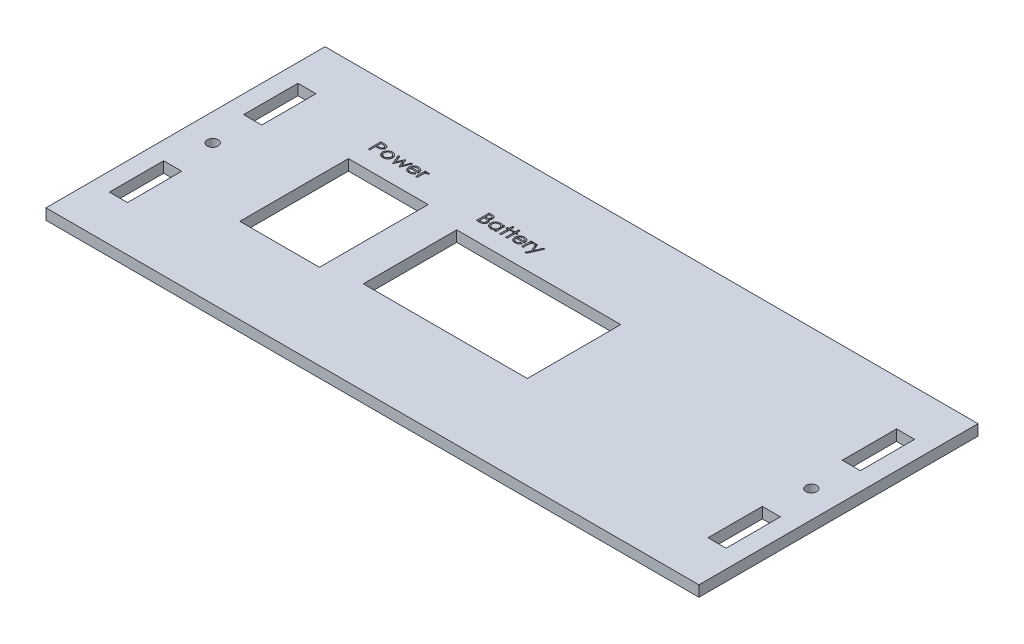
from build123d import *

# Parameters (mm, degrees)
SCHIZZO1_W                   = 180.34
SCHIZZO1_H                   = 77.07
ESTRUSIONE_ESTRUSIONE1_DEPTH = 3
SCHIZZO2_R                   = 1.5
SCHIZZO2_W                   = 5
SCHIZZO2_H                   = 15
TAGLIO_ESTRUSIONE1_DEPTH     = 99.104918964
SCHIZZO3_W                   = 45.3
SCHIZZO3_H                   = 25.8
SCHIZZO3_W_2                 = 22
SCHIZZO3_H_2                 = 30
TAGLIO_ESTRUSIONE2_DEPTH     = 99.104918964
TAGLIO_ESTRUSIONE3_DEPTH     = 1
TAGLIO_ESTRUSIONE4_DEPTH     = 1


with BuildPart() as part:
    # Schizzo1 → Estrusione-Estrusione1 (new body)
    with BuildSketch(Plane(origin=(0, 0, 0), x_dir=(1, 0, 0), z_dir=(0, 1, 0))):
        Rectangle(SCHIZZO1_W, SCHIZZO1_H)
    extrude(amount=ESTRUSIONE_ESTRUSIONE1_DEPTH)

    # Schizzo2 → Taglio-Estrusione1 (cut, through all)
    with BuildSketch(Plane(origin=(0, 0, 0), x_dir=(1, 0, 0), z_dir=(0, 1, 0))):
        with Locations((-82.67, 0)):
            Circle(SCHIZZO2_R)
        with Locations((82.67, 0)):
            Circle(SCHIZZO2_R)
        with Locations((-82.67, 18.535)):
            Rectangle(SCHIZZO2_W, SCHIZZO2_H)
        with Locations((-82.67, -18.535)):
            Rectangle(SCHIZZO2_W, SCHIZZO2_H)
        with Locations((82.67, -18.535)):
            Rectangle(SCHIZZO2_W, SCHIZZO2_H)
        with Locations((82.67, 18.535)):
            Rectangle(SCHIZZO2_W, SCHIZZO2_H)
    extrude(amount=TAGLIO_ESTRUSIONE1_DEPTH, mode=Mode.SUBTRACT)

    # Schizzo3 → Taglio-Estrusione2 (cut, through all)
    with BuildSketch(Plane(origin=(0, 0, 0), x_dir=(1, 0, 0), z_dir=(0, 1, 0))):
        with Locations((-5.52, 0)):
            Rectangle(SCHIZZO3_W, SCHIZZO3_H)
        with Locations((-49.17, 0)):
            Rectangle(SCHIZZO3_W_2, SCHIZZO3_H_2)
    extrude(amount=TAGLIO_ESTRUSIONE2_DEPTH, mode=Mode.SUBTRACT)

    # Schizzo4 → Taglio-Estrusione3 (cut)
    # profile 1 of 7: a face of its own
    with BuildSketch(Plane(origin=(0, 3, 0), x_dir=(1, 0, 0), z_dir=(0, 1, 0))):
        with BuildLine():
            Line((-27.721282051, 21.4), (-27.010344551, 21.4))
            add(Edge.make_bspline(
                [(-27.010344551, 21.4), (-26.975512489, 21.399880445), (-26.907901877, 21.399648383), (-26.809468419, 21.393576376), (-26.716881837, 21.385217637), (-26.629900509, 21.374684472), (-26.549090313, 21.358760238), (-26.474003053, 21.341039616), (-26.404852856, 21.319273206), (-26.32181816, 21.285928555), (-26.22684833, 21.236763452), (-26.12618551, 21.162915024), (-26.038636629, 21.07645617), (-25.966219425, 20.977667295), (-25.908930469, 20.870498168), (-25.866837195, 20.757921064), (-25.841651906, 20.640627626), (-25.838334155, 20.560876083), (-25.836666667, 20.520793269)],
                knots=[0, 0, 0, 0, 1.007958579, 1.956493294, 2.853051435, 3.69876748, 4.490758369, 5.235590101, 5.930857791, 6.586533057, 7.824014415, 9.014592828, 10.186442765, 11.371570779, 12.545761065, 13.692928573, 14.840474926, 16, 16, 16, 16], degree=3))
            add(Edge.make_bspline(
                [(-25.836666667, 20.520793269), (-25.838097439, 20.483316811), (-25.840925182, 20.409249289), (-25.861017361, 20.300045305), (-25.894740632, 20.195158689), (-25.941805515, 20.096228704), (-25.998673946, 20.004881066), (-26.068761704, 19.927059819), (-26.147555195, 19.860768065), (-26.207610576, 19.828721119), (-26.237708333, 19.812660256)],
                knots=[0, 0, 0, 0, 1.049068526, 2.073352407, 3.097740801, 4.125217979, 5.134529868, 6.0985968, 7.047080017, 8, 8, 8, 8], degree=3))
            add(Edge.make_bspline(
                [(-26.237708333, 19.812660256), (-26.201903156, 19.800772337), (-26.132238439, 19.777642484), (-26.034681131, 19.731486439), (-25.946353959, 19.677660249), (-25.868124222, 19.614722255), (-25.799552695, 19.544896005), (-25.738426844, 19.47013794), (-25.686314196, 19.389282289), (-25.643948432, 19.302651098), (-25.60900148, 19.212570596), (-25.585697898, 19.11852298), (-25.570121078, 19.022079984), (-25.56833643, 18.956652487), (-25.567435897, 18.923637821)],
                knots=[0, 0, 0, 0, 1.133419977, 2.205250392, 3.236826218, 4.236512947, 5.215313127, 6.174419893, 7.135300951, 8.100002318, 9.069604306, 10.034177721, 11.008047523, 12, 12, 12, 12], degree=3))
            add(Edge.make_bspline(
                [(-25.567435897, 18.923637821), (-25.568373631, 18.88946805), (-25.570225923, 18.821972997), (-25.585135888, 18.722434596), (-25.610833484, 18.626804781), (-25.644974124, 18.534107631), (-25.690420006, 18.445507835), (-25.745386093, 18.360259095), (-25.810399726, 18.278738965), (-25.884095559, 18.201278669), (-25.966688213, 18.130332131), (-26.057305054, 18.068652309), (-26.155095664, 18.016330709), (-26.260040649, 17.973323162), (-26.372738829, 17.940781259), (-26.492313636, 17.916867379), (-26.619018961, 17.902850181), (-26.705789048, 17.900965328), (-26.750228365, 17.9)],
                knots=[0, 0, 0, 0, 0.936774787, 1.85039767, 2.752028152, 3.648404466, 4.554125646, 5.47676296, 6.425627069, 7.40928418, 8.404729492, 9.405524488, 10.409085955, 11.440939351, 12.509690097, 13.620780345, 14.781482169, 16, 16, 16, 16], degree=3))
            Line((-26.750228365, 17.9), (-27.721282051, 17.9))
            Line((-27.721282051, 17.9), (-27.721282051, 21.4))
        make_face()
        with BuildLine():
            Line((-27.272564103, 20.996153846), (-27.272564103, 19.964102564))
            Line((-27.272564103, 19.964102564), (-27.159683494, 19.964102564))
            add(Edge.make_bspline(
                [(-27.159683494, 19.964102564), (-27.130464212, 19.96408051), (-27.074338657, 19.964038149), (-26.993242775, 19.968072108), (-26.918393486, 19.972582628), (-26.84959971, 19.979447893), (-26.78722123, 19.988761286), (-26.730607698, 19.998736631), (-26.680586197, 20.012102039), (-26.622537206, 20.031433106), (-26.558319564, 20.062133955), (-26.489104124, 20.107314707), (-26.428771312, 20.161983159), (-26.377929364, 20.225144014), (-26.336204248, 20.294303656), (-26.306819661, 20.368471797), (-26.288265652, 20.446265232), (-26.286354631, 20.499420924), (-26.285384615, 20.526402244)],
                knots=[0, 0, 0, 0, 1.189795604, 2.285406617, 3.306016107, 4.243629591, 5.09972607, 5.874440047, 6.583200089, 7.20625147, 8.364329942, 9.470433385, 10.562068177, 11.665054906, 12.761988123, 13.838370909, 14.902777763, 16, 16, 16, 16], degree=3))
            add(Edge.make_bspline(
                [(-26.285384615, 20.526402244), (-26.285634902, 20.544200578), (-26.286124866, 20.579042867), (-26.294431679, 20.62944457), (-26.305994173, 20.677388781), (-26.323720561, 20.721922497), (-26.345587657, 20.763896296), (-26.372412414, 20.802990571), (-26.40502718, 20.838425413), (-26.441607342, 20.871956681), (-26.484090624, 20.901734181), (-26.532961437, 20.926550351), (-26.587438684, 20.948789004), (-26.6485148, 20.96558324), (-26.715635846, 20.979951636), (-26.78903247, 20.989351791), (-26.868631587, 20.994882044), (-26.923629504, 20.995719527), (-26.952151442, 20.996153846)],
                knots=[0, 0, 0, 0, 0.920588044, 1.802157111, 2.638793445, 3.470424406, 4.277107445, 5.086238418, 5.917516993, 6.765890369, 7.652348103, 8.594329737, 9.598999334, 10.694623565, 11.869668103, 13.151790333, 14.522917531, 16, 16, 16, 16], degree=3))
            Line((-26.952151442, 20.996153846), (-27.272564103, 20.996153846))
        make_face(mode=Mode.SUBTRACT)
        with BuildLine():
            Line((-27.272564103, 19.56025641), (-27.272564103, 18.303846154))
            Line((-27.272564103, 18.303846154), (-26.929014423, 18.303846154))
            add(Edge.make_bspline(
                [(-26.929014423, 18.303846154), (-26.898865922, 18.304238817), (-26.8406601, 18.304996906), (-26.756685706, 18.307296665), (-26.67906548, 18.313117782), (-26.607961618, 18.320659123), (-26.543018276, 18.330079436), (-26.485122777, 18.342963233), (-26.433096486, 18.356573094), (-26.373216733, 18.378807692), (-26.306200799, 18.413291383), (-26.233333251, 18.463240598), (-26.170069139, 18.524355432), (-26.115612678, 18.593476378), (-26.07127903, 18.668850002), (-26.039718232, 18.748563163), (-26.019692229, 18.831043445), (-26.01733736, 18.887067636), (-26.016153846, 18.915224359)],
                knots=[0, 0, 0, 0, 1.163785926, 2.246848597, 3.241725633, 4.167152819, 5.00659376, 5.772700295, 6.455464292, 7.08048881, 8.234268396, 9.355318846, 10.478218647, 11.615125307, 12.742977958, 13.840148171, 14.914498376, 16, 16, 16, 16], degree=3))
            add(Edge.make_bspline(
                [(-26.016153846, 18.915224359), (-26.017560683, 18.950470246), (-26.020323742, 19.019693993), (-26.048489164, 19.119385816), (-26.092537184, 19.212300006), (-26.154016566, 19.297120456), (-26.230779686, 19.372625552), (-26.322468733, 19.435368625), (-26.427765032, 19.484990943), (-26.503991972, 19.506875761), (-26.543397436, 19.518189103)],
                knots=[0, 0, 0, 0, 0.973192407, 1.911372656, 2.842841623, 3.806662698, 4.794486549, 5.808057144, 6.866876674, 8, 8, 8, 8], degree=3))
            add(Edge.make_bspline(
                [(-26.543397436, 19.518189103), (-26.559724083, 19.521647207), (-26.594778311, 19.529071951), (-26.651982829, 19.536884735), (-26.716883534, 19.545048825), (-26.790168434, 19.549908165), (-26.871453874, 19.555409586), (-26.961029012, 19.557471783), (-27.058708175, 19.559987803), (-27.12649469, 19.560164444), (-27.161786859, 19.56025641)],
                knots=[0, 0, 0, 0, 0.644909758, 1.384657469, 2.230684102, 3.173004705, 4.222865052, 5.379792601, 6.635823043, 8, 8, 8, 8], degree=3))
            Line((-27.161786859, 19.56025641), (-27.272564103, 19.56025641))
        make_face(mode=Mode.SUBTRACT)
    # profile 2 of 7: a face of its own
    with BuildSketch(Plane(origin=(0, 3, 0), x_dir=(1, 0, 0), z_dir=(0, 1, 0))):
        with BuildLine():
            Line((-22.336666667, 20.502564103), (-22.336666667, 17.9))
            Line((-22.336666667, 17.9), (-22.785384615, 17.9))
            Line((-22.785384615, 17.9), (-22.785384615, 18.333994391))
            add(Edge.make_bspline(
                [(-22.785384615, 18.333994391), (-22.793361161, 18.315314052), (-22.809373824, 18.277813859), (-22.8413969, 18.225375017), (-22.878868795, 18.175715991), (-22.922459636, 18.129523627), (-22.971832724, 18.086646396), (-23.026900537, 18.047061761), (-23.088263386, 18.011609802), (-23.177227671, 17.967711362), (-23.296191519, 17.922173841), (-23.44661922, 17.884129375), (-23.603695085, 17.859106968), (-23.711001395, 17.856469181), (-23.765552885, 17.855128205)],
                knots=[0, 0, 0, 0, 0.633448184, 1.271627253, 1.912262546, 2.572984541, 3.250455464, 3.951067024, 4.686888255, 5.460243522, 7.046999963, 8.652120303, 10.298032742, 12, 12, 12, 12], degree=3))
            add(Edge.make_bspline(
                [(-23.765552885, 17.855128205), (-23.811418195, 17.856369648), (-23.901880305, 17.8588182), (-24.035096162, 17.877377496), (-24.163046225, 17.908263129), (-24.286037047, 17.951181697), (-24.403723815, 18.006961755), (-24.516158118, 18.075236832), (-24.62315312, 18.155893156), (-24.724122506, 18.246886124), (-24.815975801, 18.347259759), (-24.897283196, 18.453967095), (-24.965338438, 18.566807845), (-25.022103275, 18.684433455), (-25.065715225, 18.807887039), (-25.096427409, 18.936665013), (-25.115071566, 19.070795247), (-25.117489193, 19.161959259), (-25.118717949, 19.208293269)],
                knots=[0, 0, 0, 0, 1.033362466, 2.038144899, 3.024299931, 3.995390054, 4.968377829, 5.953815345, 6.954489863, 7.983669828, 9.012499361, 10.016342745, 11.001780262, 11.977031811, 12.954839801, 13.946114836, 14.956115094, 16, 16, 16, 16], degree=3))
            add(Edge.make_bspline(
                [(-25.118717949, 19.208293269), (-25.117551711, 19.253470911), (-25.115245014, 19.342827615), (-25.095522322, 19.474030275), (-25.065185966, 19.600705918), (-25.020287812, 19.721655844), (-24.96411646, 19.83813144), (-24.894863907, 19.949403726), (-24.812973435, 20.05561637), (-24.71988298, 20.155723156), (-24.617592203, 20.24648783), (-24.509854222, 20.327365345), (-24.396693123, 20.395606271), (-24.278312973, 20.451387748), (-24.154623307, 20.494308255), (-24.026197134, 20.52510673), (-23.8925365, 20.543792215), (-23.801837647, 20.546208001), (-23.755737179, 20.547435897)],
                knots=[0, 0, 0, 0, 1.020618803, 2.018678488, 2.992382782, 3.959992561, 4.92863996, 5.910776111, 6.916619819, 7.955690666, 8.995808327, 10.003702857, 10.996604865, 11.977276721, 12.956254092, 13.950490127, 14.958273908, 16, 16, 16, 16], degree=3))
            add(Edge.make_bspline(
                [(-23.755737179, 20.547435897), (-23.700008917, 20.545917648), (-23.590763033, 20.542941376), (-23.431183615, 20.516639038), (-23.279160064, 20.475742758), (-23.159921353, 20.426655708), (-23.071124943, 20.37985478), (-23.011005995, 20.341513262), (-22.956786609, 20.29998921), (-22.909973497, 20.25418783), (-22.86869729, 20.205610121), (-22.834226289, 20.153322912), (-22.805623648, 20.097676276), (-22.792155872, 20.058246013), (-22.785384615, 20.038421474)],
                knots=[0, 0, 0, 0, 1.716657277, 3.365217784, 4.971270217, 6.560530054, 7.327512158, 8.062889103, 8.755980397, 9.428436733, 10.077769018, 10.717114698, 11.354997714, 12, 12, 12, 12], degree=3))
            Line((-22.785384615, 20.038421474), (-22.785384615, 20.502564103))
            Line((-22.785384615, 20.502564103), (-22.336666667, 20.502564103))
        make_face()
        with BuildLine():
            add(Edge.make_bspline(
                [(-23.748725962, 20.143589744), (-23.788324706, 20.14232667), (-23.866733023, 20.139825695), (-23.982030498, 20.117225876), (-24.093230959, 20.080469814), (-24.199401325, 20.029204152), (-24.299716105, 19.965032549), (-24.389973385, 19.885265574), (-24.471135712, 19.792758526), (-24.541320308, 19.688149896), (-24.598622903, 19.57501791), (-24.639769592, 19.45545334), (-24.665053417, 19.331585329), (-24.668345206, 19.247205622), (-24.67, 19.20478766)],
                knots=[0, 0, 0, 0, 0.974506396, 1.929591628, 2.881601621, 3.852224148, 4.826169364, 5.805204388, 6.808608303, 7.849533547, 8.899838684, 9.922896291, 10.95583298, 12, 12, 12, 12], degree=3))
            add(Edge.make_bspline(
                [(-24.67, 19.20478766), (-24.668362239, 19.162366559), (-24.665113185, 19.078209948), (-24.639575836, 18.95409819), (-24.598068364, 18.834005517), (-24.539730846, 18.719882471), (-24.469189516, 18.614361337), (-24.387929728, 18.520499478), (-24.29672466, 18.440757759), (-24.1970887, 18.374441159), (-24.090399899, 18.323945187), (-23.980538566, 18.285956777), (-23.866937764, 18.26370269), (-23.790185842, 18.260558102), (-23.751530449, 18.258974359)],
                knots=[0, 0, 0, 0, 1.043890897, 2.07091085, 3.106456601, 4.164214128, 5.217626504, 6.225096955, 7.211993606, 8.19198703, 9.162352883, 10.110485497, 11.048363551, 12, 12, 12, 12], degree=3))
            add(Edge.make_bspline(
                [(-23.751530449, 18.258974359), (-23.708891792, 18.260431131), (-23.624378026, 18.263318589), (-23.499401711, 18.287352734), (-23.3785878, 18.326968045), (-23.262284392, 18.380672624), (-23.154650277, 18.448048041), (-23.057900062, 18.52674041), (-22.97608005, 18.617872304), (-22.906771277, 18.718185074), (-22.853118995, 18.828094688), (-22.813281577, 18.944533683), (-22.789616958, 19.068049653), (-22.786814078, 19.152568613), (-22.785384615, 19.195673077)],
                knots=[0, 0, 0, 0, 1.022399401, 2.026490321, 3.040784809, 4.066867991, 5.092169477, 6.080081507, 7.048709079, 8.02078757, 8.996288655, 9.973335651, 10.966406111, 12, 12, 12, 12], degree=3))
            add(Edge.make_bspline(
                [(-22.785384615, 19.195673077), (-22.786114094, 19.228671903), (-22.787553375, 19.293779438), (-22.801278882, 19.389113876), (-22.823168779, 19.480387326), (-22.852910436, 19.567664895), (-22.893035345, 19.650200105), (-22.940358037, 19.729218188), (-22.998138049, 19.803004777), (-23.062685987, 19.872652893), (-23.133776148, 19.936089876), (-23.209476286, 19.991766751), (-23.2897653, 20.03840592), (-23.373648125, 20.077227675), (-23.462033882, 20.106329427), (-23.553817335, 20.128663706), (-23.649987927, 20.141170097), (-23.715505585, 20.142775654), (-23.748725962, 20.143589744)],
                knots=[0, 0, 0, 0, 1.049538253, 2.070766012, 3.057425551, 4.033461752, 4.998098599, 5.972518539, 6.958729546, 7.974309418, 8.990869055, 9.985984514, 10.959183395, 11.940869635, 12.921541271, 13.915433273, 14.94303162, 16, 16, 16, 16], degree=3))
        make_face(mode=Mode.SUBTRACT)
    # profile 3 of 7: a face of its own
    with BuildSketch(Plane(origin=(0, 3, 0), x_dir=(1, 0, 0), z_dir=(0, 1, 0))):
        Polygon((-21.304615385, 21.48974359), (-20.855897436, 21.48974359), (-20.855897436, 20.502564103), (-20.407179487, 20.502564103), (-20.407179487, 20.098717949), (-20.855897436, 20.098717949), (-20.855897436, 17.9), (-21.304615385, 17.9), (-21.304615385, 20.098717949), (-21.753333333, 20.098717949), (-21.753333333, 20.502564103), (-21.304615385, 20.502564103), align=None)
    # profile 4 of 7: a face of its own
    with BuildSketch(Plane(origin=(0, 3, 0), x_dir=(1, 0, 0), z_dir=(0, 1, 0))):
        Polygon((-19.644358974, 21.48974359), (-19.195641026, 21.48974359), (-19.195641026, 20.502564103), (-18.746923077, 20.502564103), (-18.746923077, 20.098717949), (-19.195641026, 20.098717949), (-19.195641026, 17.9), (-19.644358974, 17.9), (-19.644358974, 20.098717949), (-20.093076923, 20.098717949), (-20.093076923, 20.502564103), (-19.644358974, 20.502564103), align=None)
    # profile 5 of 7: a face of its own
    with BuildSketch(Plane(origin=(0, 3, 0), x_dir=(1, 0, 0), z_dir=(0, 1, 0))):
        with BuildLine():
            Line((-16.159082532, 18.797435897), (-15.785384615, 18.61864984))
            add(Edge.make_bspline(
                [(-15.785384615, 18.61864984), (-15.809010227, 18.575713264), (-15.855019004, 18.492098104), (-15.93352693, 18.376635147), (-16.018727888, 18.275091936), (-16.109793751, 18.186344646), (-16.207860642, 18.110414222), (-16.311163494, 18.04305139), (-16.421893351, 17.986568005), (-16.538629041, 17.938287878), (-16.662902934, 17.901134528), (-16.794562028, 17.874740251), (-16.933875366, 17.858298432), (-17.02936196, 17.856201752), (-17.078253205, 17.855128205)],
                knots=[0, 0, 0, 0, 1.110387997, 2.162381809, 3.158716456, 4.110235088, 5.03849693, 5.965639636, 6.901458115, 7.851707839, 8.825366416, 9.836184406, 10.892078622, 12, 12, 12, 12], degree=3))
            add(Edge.make_bspline(
                [(-17.078253205, 17.855128205), (-17.12997422, 17.85619375), (-17.231003995, 17.858275142), (-17.377855545, 17.878734593), (-17.516423654, 17.90969504), (-17.646206357, 17.954535505), (-17.766702715, 18.013428941), (-17.879350535, 18.083749316), (-17.982825903, 18.167682165), (-18.076140685, 18.263814107), (-18.159032361, 18.367637776), (-18.233115694, 18.475062862), (-18.293710458, 18.587167164), (-18.344888855, 18.701786948), (-18.384284334, 18.820158423), (-18.412196367, 18.941762673), (-18.429724411, 19.066857371), (-18.431779853, 19.151444688), (-18.432820513, 19.194270833)],
                knots=[0, 0, 0, 0, 1.164566152, 2.274817246, 3.333639364, 4.359360714, 5.360157823, 6.349126428, 7.344925074, 8.35392925, 9.361228562, 10.335284257, 11.289572886, 12.22779236, 13.160187688, 14.095091993, 15.035554391, 16, 16, 16, 16], degree=3))
            add(Edge.make_bspline(
                [(-18.432820513, 19.194270833), (-18.431909352, 19.234283481), (-18.430102088, 19.313647593), (-18.414687847, 19.430856717), (-18.391189664, 19.544961696), (-18.357341052, 19.655496005), (-18.313534007, 19.76265419), (-18.26009722, 19.866585297), (-18.196994223, 19.967260265), (-18.1482361, 20.030393557), (-18.123625801, 20.062259615)],
                knots=[0, 0, 0, 0, 1.021096707, 2.025320431, 3.012923591, 3.992437812, 4.971861174, 5.964497656, 6.972595394, 8, 8, 8, 8], degree=3))
            add(Edge.make_bspline(
                [(-18.123625801, 20.062259615), (-18.090345096, 20.100923157), (-18.024747571, 20.177130456), (-17.912956534, 20.276250754), (-17.79315261, 20.360586772), (-17.664546438, 20.428665336), (-17.528091536, 20.482756513), (-17.383008687, 20.520155189), (-17.229726533, 20.543101737), (-17.124843043, 20.545970041), (-17.071241987, 20.547435897)],
                knots=[0, 0, 0, 0, 1.018725525, 2.007946416, 2.977291296, 3.940674949, 4.909614547, 5.904411593, 6.929042575, 8, 8, 8, 8], degree=3))
            add(Edge.make_bspline(
                [(-17.071241987, 20.547435897), (-17.01342573, 20.546103701), (-16.900547222, 20.543502765), (-16.736330081, 20.518887887), (-16.581438499, 20.480007065), (-16.436261379, 20.424339559), (-16.300505214, 20.352955146), (-16.174206222, 20.266145294), (-16.05712325, 20.163400461), (-15.989397274, 20.08372807), (-15.95505609, 20.043329327)],
                knots=[0, 0, 0, 0, 1.092510559, 2.132980742, 3.131821249, 4.106721871, 5.065344059, 6.025034973, 6.998572742, 8, 8, 8, 8], degree=3))
            add(Edge.make_bspline(
                [(-15.95505609, 20.043329327), (-15.931011616, 20.012009867), (-15.883076729, 19.949571624), (-15.823024007, 19.847261463), (-15.770794402, 19.739811955), (-15.727768032, 19.625824043), (-15.695414156, 19.505433817), (-15.670388549, 19.379502668), (-15.655957998, 19.247411787), (-15.652984335, 19.157377603), (-15.651470353, 19.111538462)],
                knots=[0, 0, 0, 0, 0.947891001, 1.889708495, 2.844047414, 3.816063809, 4.811874475, 5.836031954, 6.898258033, 8, 8, 8, 8], degree=3))
            Line((-15.651470353, 19.111538462), (-17.984803686, 19.111538462))
            add(Edge.make_bspline(
                [(-17.984803686, 19.111538462), (-17.983599962, 19.081792695), (-17.981236122, 19.023378765), (-17.966340556, 18.938068688), (-17.945671914, 18.85623335), (-17.916708107, 18.777999741), (-17.880041567, 18.703318464), (-17.835817394, 18.63223848), (-17.783366647, 18.565299832), (-17.724166181, 18.502690254), (-17.659573111, 18.445725464), (-17.591327677, 18.395676129), (-17.519943767, 18.35290522), (-17.4449754, 18.318961195), (-17.36714357, 18.291721885), (-17.286208287, 18.273329362), (-17.202293053, 18.260490191), (-17.145143729, 18.259484975), (-17.116113782, 18.258974359)],
                knots=[0, 0, 0, 0, 1.056285998, 2.074305788, 3.068874036, 4.051103373, 5.031155672, 6.019259974, 7.018838325, 8.046424154, 9.075617995, 10.073437039, 11.048590896, 12.025474346, 12.991505956, 13.972050267, 14.969869311, 16, 16, 16, 16], degree=3))
            add(Edge.make_bspline(
                [(-17.116113782, 18.258974359), (-17.084990536, 18.259559574), (-17.023006061, 18.260725077), (-16.931237302, 18.272820221), (-16.8407812, 18.289773019), (-16.75316227, 18.315463309), (-16.669043758, 18.345534318), (-16.591052888, 18.381427433), (-16.519873946, 18.421345631), (-16.4527792, 18.467525058), (-16.385935999, 18.52542373), (-16.315515173, 18.599876046), (-16.238673043, 18.692149402), (-16.186822779, 18.760739646), (-16.159082532, 18.797435897)],
                knots=[0, 0, 0, 0, 0.974501181, 1.940798391, 2.895710587, 3.855187413, 4.797895034, 5.692306932, 6.541458453, 7.351844759, 8.239729442, 9.306468335, 10.558942083, 12, 12, 12, 12], degree=3))
        make_face()
        with BuildLine():
            add(Edge.make_bspline(
                [(-16.099487179, 19.515384615), (-16.110857659, 19.544371821), (-16.133535271, 19.602184742), (-16.177195739, 19.684256266), (-16.228891864, 19.760902105), (-16.287177592, 19.833290991), (-16.355026278, 19.899892501), (-16.433533164, 19.959331493), (-16.521832697, 20.013226529), (-16.619950203, 20.058419665), (-16.724009331, 20.096124264), (-16.831945226, 20.123756061), (-16.942660966, 20.140233197), (-17.017434532, 20.142465027), (-17.055116186, 20.143589744)],
                knots=[0, 0, 0, 0, 0.917468198, 1.829825112, 2.733739057, 3.639830069, 4.565591991, 5.528900948, 6.536885056, 7.609579627, 8.708054817, 9.795976896, 10.889296829, 12, 12, 12, 12], degree=3))
            add(Edge.make_bspline(
                [(-17.055116186, 20.143589744), (-17.083887984, 20.142863894), (-17.140896895, 20.141425683), (-17.225140467, 20.131542886), (-17.306810171, 20.114756514), (-17.385867978, 20.090725758), (-17.462254694, 20.05977809), (-17.536404036, 20.022353989), (-17.608038309, 19.978344962), (-17.65297882, 19.944158151), (-17.675608974, 19.926943109)],
                knots=[0, 0, 0, 0, 1.030056501, 2.040970785, 3.032161429, 4.011555994, 4.995123754, 5.979296403, 6.982458509, 8, 8, 8, 8], degree=3))
            add(Edge.make_bspline(
                [(-17.675608974, 19.926943109), (-17.70434393, 19.901647995), (-17.763151914, 19.849879875), (-17.836155638, 19.75270686), (-17.901830088, 19.641298487), (-17.934740175, 19.558456343), (-17.951850962, 19.515384615)],
                knots=[0, 0, 0, 0, 0.913853049, 1.870260628, 2.892694598, 4, 4, 4, 4], degree=3))
            Line((-17.951850962, 19.515384615), (-16.099487179, 19.515384615))
        make_face(mode=Mode.SUBTRACT)
    # profile 6 of 7: a face of its own
    with BuildSketch(Plane(origin=(0, 3, 0), x_dir=(1, 0, 0), z_dir=(0, 1, 0))):
        with BuildLine():
            Line((-15.246923077, 20.502564103), (-14.798205128, 20.502564103))
            Line((-14.798205128, 20.502564103), (-14.798205128, 20.133072917))
            add(Edge.make_bspline(
                [(-14.798205128, 20.133072917), (-14.79549756, 20.149966016), (-14.79021277, 20.182938951), (-14.776882172, 20.230322614), (-14.758444238, 20.274314631), (-14.735268936, 20.314965055), (-14.707784562, 20.352428287), (-14.675712197, 20.386470293), (-14.639201034, 20.417567897), (-14.583962753, 20.453112014), (-14.511438504, 20.490706482), (-14.420440016, 20.523332794), (-14.327281736, 20.544001661), (-14.264055421, 20.546290128), (-14.23239984, 20.547435897)],
                knots=[0, 0, 0, 0, 0.801625561, 1.56465941, 2.301277113, 3.032414989, 3.753384473, 4.4742707, 5.220602463, 5.995500889, 7.548895402, 9.039144265, 10.517585467, 12, 12, 12, 12], degree=3))
            add(Edge.make_bspline(
                [(-14.23239984, 20.547435897), (-14.203768846, 20.545735685), (-14.143618661, 20.54216375), (-14.051225226, 20.518348411), (-13.953935443, 20.479042544), (-13.889673957, 20.443907866), (-13.855897436, 20.425440705)],
                knots=[0, 0, 0, 0, 0.858860638, 1.804360244, 2.845948385, 4, 4, 4, 4], degree=3))
            Line((-13.855897436, 20.425440705), (-14.06833734, 20.099419071))
            add(Edge.make_bspline(
                [(-14.06833734, 20.099419071), (-14.092569686, 20.106273931), (-14.136837664, 20.118796482), (-14.197856951, 20.131553766), (-14.246135533, 20.141222376), (-14.274439008, 20.142887061), (-14.286386218, 20.143589744)],
                knots=[0, 0, 0, 0, 1.354987806, 2.475310119, 3.356411532, 4, 4, 4, 4], degree=3))
            add(Edge.make_bspline(
                [(-14.286386218, 20.143589744), (-14.305962625, 20.142154169), (-14.347166215, 20.139132632), (-14.408630402, 20.115384327), (-14.471737208, 20.078744425), (-14.523729061, 20.037718289), (-14.565439111, 19.997617549), (-14.595280444, 19.960833648), (-14.62424264, 19.919203509), (-14.651431571, 19.87230556), (-14.676523382, 19.820100375), (-14.700253352, 19.763190078), (-14.723048048, 19.701359658), (-14.73561601, 19.657801852), (-14.742115385, 19.635276442)],
                knots=[0, 0, 0, 0, 0.965356871, 2.031842204, 3.216327082, 4.56533618, 5.292082419, 6.07124699, 6.900886396, 7.796081313, 8.746333432, 9.760722644, 10.841983902, 12, 12, 12, 12], degree=3))
            add(Edge.make_bspline(
                [(-14.742115385, 19.635276442), (-14.746861071, 19.61664213), (-14.75750873, 19.574833261), (-14.76753307, 19.503858549), (-14.777625898, 19.419049217), (-14.784725676, 19.320066033), (-14.791269285, 19.207191629), (-14.794991349, 19.080005947), (-14.798077852, 18.938610388), (-14.798161392, 18.839505448), (-14.798205128, 18.787620192)],
                knots=[0, 0, 0, 0, 0.541796663, 1.215601946, 2.018210726, 2.950106988, 4.012619945, 5.205915212, 6.537188929, 8, 8, 8, 8], degree=3))
            Line((-14.798205128, 18.787620192), (-14.798205128, 17.9))
            Line((-14.798205128, 17.9), (-15.246923077, 17.9))
            Line((-15.246923077, 17.9), (-15.246923077, 20.502564103))
        make_face()
    # profile 7 of 7: a face of its own
    with BuildSketch(Plane(origin=(0, 3, 0), x_dir=(1, 0, 0), z_dir=(0, 1, 0))):
        Polygon((-13.900769231, 20.502564103), (-13.447143429, 20.502564103), (-12.626830929, 18.580088141), (-11.802311699, 20.502564103), (-11.343076923, 20.502564103), (-12.933922276, 16.957692308), (-13.388249199, 16.957692308), (-12.862407853, 18.158713942), align=None)
    extrude(amount=-TAGLIO_ESTRUSIONE3_DEPTH, mode=Mode.SUBTRACT)

    # Schizzo5 → Taglio-Estrusione4 (cut)
    # profile 1 of 5: a face of its own
    with BuildSketch(Plane(origin=(0, 3, 0), x_dir=(1, 0, 0), z_dir=(0, 1, 0))):
        with BuildLine():
            Line((-59.721282051, 23.5), (-59.004034455, 23.5))
            add(Edge.make_bspline(
                [(-59.004034455, 23.5), (-58.956589121, 23.499974153), (-58.865662184, 23.499924617), (-58.735263232, 23.496567938), (-58.616962019, 23.493670846), (-58.510583749, 23.488102386), (-58.416370619, 23.480474665), (-58.334288809, 23.471505378), (-58.264250186, 23.461417408), (-58.222011407, 23.452297078), (-58.202652244, 23.448116987)],
                knots=[0, 0, 0, 0, 1.415450773, 2.712650385, 3.891531898, 4.945867971, 5.890285756, 6.71109784, 7.409261617, 8, 8, 8, 8], degree=3))
            add(Edge.make_bspline(
                [(-58.202652244, 23.448116987), (-58.175399632, 23.441108824), (-58.121638582, 23.427283866), (-58.044785162, 23.39878654), (-57.971861648, 23.366405202), (-57.903117014, 23.329570336), (-57.83925346, 23.28702804), (-57.778893162, 23.240806502), (-57.723892712, 23.188567902), (-57.672367839, 23.132846449), (-57.627159619, 23.072369421), (-57.586652924, 23.00918318), (-57.553079034, 22.942369961), (-57.525486977, 22.872178288), (-57.503917268, 22.798974125), (-57.488401865, 22.722524234), (-57.479078827, 22.642996256), (-57.47816019, 22.588800877), (-57.477692308, 22.561197917)],
                knots=[0, 0, 0, 0, 1.085641105, 2.141637125, 3.15936318, 4.164535163, 5.147931294, 6.118832473, 7.09541784, 8.072503165, 9.045079613, 10.006206652, 10.966486436, 11.926469503, 12.914201526, 13.908586125, 14.934794539, 16, 16, 16, 16], degree=3))
            add(Edge.make_bspline(
                [(-57.477692308, 22.561197917), (-57.478170456, 22.533596243), (-57.47911327, 22.479171129), (-57.488377434, 22.399167722), (-57.503906898, 22.322559015), (-57.524843509, 22.249006576), (-57.552358862, 22.178967838), (-57.58523743, 22.111851512), (-57.624981314, 22.048418008), (-57.670353644, 21.98822703), (-57.721591952, 21.932203586), (-57.777953653, 21.880560318), (-57.840179603, 21.834199154), (-57.907631605, 21.79228796), (-57.980074619, 21.7540918), (-58.058237429, 21.721238911), (-58.141771313, 21.69324512), (-58.199745714, 21.678360054), (-58.229294872, 21.670773237)],
                knots=[0, 0, 0, 0, 1.042501879, 2.055610221, 3.037454288, 3.993184118, 4.940927036, 5.876790881, 6.812738028, 7.76458517, 8.720845088, 9.677105007, 10.648370915, 11.647960469, 12.67482723, 13.739162042, 14.847666245, 16, 16, 16, 16], degree=3))
            add(Edge.make_bspline(
                [(-58.229294872, 21.670773237), (-58.250981654, 21.666071387), (-58.298290921, 21.655814397), (-58.376797803, 21.645141265), (-58.468274347, 21.636397204), (-58.57300967, 21.62878971), (-58.690574463, 21.622399347), (-58.821490194, 21.618595316), (-58.965458282, 21.615525746), (-59.065964867, 21.615432951), (-59.118317308, 21.615384615)],
                knots=[0, 0, 0, 0, 0.596754895, 1.30180848, 2.129432098, 3.068723067, 4.126429569, 5.296393252, 6.591729958, 8, 8, 8, 8], degree=3))
            Line((-59.118317308, 21.615384615), (-59.272564103, 21.615384615))
            Line((-59.272564103, 21.615384615), (-59.272564103, 20))
            Line((-59.272564103, 20), (-59.721282051, 20))
            Line((-59.721282051, 20), (-59.721282051, 23.5))
        make_face()
        with BuildLine():
            Line((-59.272564103, 23.096153846), (-59.272564103, 22.017828526))
            Line((-59.272564103, 22.017828526), (-58.76775641, 22.012219551))
            add(Edge.make_bspline(
                [(-58.76775641, 22.012219551), (-58.739243058, 22.012595538), (-58.684306807, 22.013319945), (-58.605029503, 22.015835172), (-58.53211122, 22.020947202), (-58.465411104, 22.026909266), (-58.404794412, 22.035268109), (-58.350534036, 22.045700349), (-58.302167314, 22.057421536), (-58.246859279, 22.075849837), (-58.184950573, 22.104624168), (-58.119134856, 22.148527848), (-58.06112057, 22.201033412), (-58.01320952, 22.262832359), (-57.97465269, 22.330922638), (-57.945992426, 22.403698577), (-57.9297702, 22.481025373), (-57.927539726, 22.533781892), (-57.926410256, 22.560496795)],
                knots=[0, 0, 0, 0, 1.196816259, 2.305888068, 3.328295896, 4.264290022, 5.116006351, 5.89509982, 6.582615619, 7.202969204, 8.339503699, 9.435837163, 10.511976311, 11.608836183, 12.702577786, 13.786378287, 14.879063815, 16, 16, 16, 16], degree=3))
            add(Edge.make_bspline(
                [(-57.926410256, 22.560496795), (-57.927547885, 22.586279417), (-57.929804329, 22.637418277), (-57.946111352, 22.712630528), (-57.974784844, 22.783971677), (-58.013404474, 22.851105469), (-58.060334581, 22.912466761), (-58.115925525, 22.965252645), (-58.178839085, 23.008393416), (-58.237573734, 23.036024317), (-58.289944709, 23.054005996), (-58.336102195, 23.064568978), (-58.388246051, 23.074445219), (-58.446700077, 23.082911935), (-58.511518653, 23.089018271), (-58.582623644, 23.092935154), (-58.659757279, 23.096004647), (-58.713299099, 23.096102837), (-58.741113782, 23.096153846)],
                knots=[0, 0, 0, 0, 1.113934591, 2.209447376, 3.306634974, 4.424089692, 5.547326231, 6.633252657, 7.723023745, 8.829884498, 9.427152571, 10.113060991, 10.873719268, 11.720735618, 12.664423995, 13.686322671, 14.798057257, 16, 16, 16, 16], degree=3))
            Line((-58.741113782, 23.096153846), (-59.272564103, 23.096153846))
        make_face(mode=Mode.SUBTRACT)
    # profile 2 of 5: a face of its own
    with BuildSketch(Plane(origin=(0, 3, 0), x_dir=(1, 0, 0), z_dir=(0, 1, 0))):
        with BuildLine():
            add(Edge.make_bspline(
                [(-55.658982372, 22.647435897), (-55.607042429, 22.646013529), (-55.505353824, 22.643228799), (-55.356556584, 22.623636908), (-55.215258492, 22.589596658), (-55.081054577, 22.543006368), (-54.954497156, 22.481966588), (-54.835270131, 22.408118995), (-54.723799772, 22.320027655), (-54.656654198, 22.252481578), (-54.622724359, 22.218349359)],
                knots=[0, 0, 0, 0, 1.078775739, 2.112039281, 3.110494877, 4.093081892, 5.057110616, 6.022958758, 7.000966324, 8, 8, 8, 8], degree=3))
            add(Edge.make_bspline(
                [(-54.622724359, 22.218349359), (-54.592635497, 22.184518286), (-54.533478449, 22.118003758), (-54.457041136, 22.010712667), (-54.391945387, 21.900343439), (-54.339281179, 21.786064), (-54.297304, 21.668396927), (-54.268192523, 21.546877278), (-54.249860314, 21.421734944), (-54.247910091, 21.337103226), (-54.246923077, 21.294270833)],
                knots=[0, 0, 0, 0, 1.062178036, 2.088324843, 3.086640365, 4.066023852, 5.037709567, 6.014384934, 6.995073642, 8, 8, 8, 8], degree=3))
            add(Edge.make_bspline(
                [(-54.246923077, 21.294270833), (-54.248156701, 21.251202095), (-54.250601574, 21.165845843), (-54.269526291, 21.039756461), (-54.299456076, 20.917025605), (-54.342510891, 20.798213576), (-54.397921432, 20.683191461), (-54.464397192, 20.571259587), (-54.544545622, 20.463907741), (-54.634660524, 20.360824663), (-54.734803697, 20.265726104), (-54.844093099, 20.182468224), (-54.96118893, 20.112009898), (-55.085879754, 20.054012972), (-55.218760237, 20.010188539), (-55.358543138, 19.977733808), (-55.506306877, 19.958567194), (-55.607276526, 19.95629287), (-55.658982372, 19.955128205)],
                knots=[0, 0, 0, 0, 0.952871876, 1.888459614, 2.815544184, 3.744891397, 4.679563604, 5.637601804, 6.621431805, 7.640342292, 8.664856555, 9.672479278, 10.67487095, 11.683873433, 12.709444777, 13.765907845, 14.855937143, 16, 16, 16, 16], degree=3))
            add(Edge.make_bspline(
                [(-55.658982372, 19.955128205), (-55.708363752, 19.956262397), (-55.805165554, 19.958485743), (-55.946622593, 19.978224188), (-56.081512296, 20.008347283), (-56.208850952, 20.053161634), (-56.329687568, 20.109202859), (-56.443213805, 20.178710857), (-56.550304087, 20.260031977), (-56.648164856, 20.354120918), (-56.73736211, 20.455269904), (-56.8147839, 20.562652976), (-56.881373935, 20.673773577), (-56.935510674, 20.789571626), (-56.976996435, 20.91000549), (-57.007372003, 21.034081297), (-57.025110084, 21.162884318), (-57.027673653, 21.250046428), (-57.028974359, 21.294270833)],
                knots=[0, 0, 0, 0, 1.108842573, 2.173652473, 3.202745058, 4.208988794, 5.200203338, 6.189803525, 7.193715926, 8.215010613, 9.234454675, 10.219573757, 11.184848795, 12.140854958, 13.08565054, 14.042002664, 15.006549187, 16, 16, 16, 16], degree=3))
            add(Edge.make_bspline(
                [(-57.028974359, 21.294270833), (-57.027914996, 21.338025415), (-57.025827842, 21.4242306), (-57.008718741, 21.551337962), (-56.979689895, 21.673469524), (-56.940556946, 21.791613682), (-56.888882119, 21.904870868), (-56.826058835, 22.013880158), (-56.752655213, 22.119044037), (-56.695436038, 22.183595601), (-56.666494391, 22.216245994)],
                knots=[0, 0, 0, 0, 1.034079547, 2.037341334, 3.024980457, 3.998111168, 4.974764182, 5.962233312, 6.969290918, 8, 8, 8, 8], degree=3))
            add(Edge.make_bspline(
                [(-56.666494391, 22.216245994), (-56.632825363, 22.250639716), (-56.566448811, 22.318444964), (-56.455965842, 22.406354353), (-56.339400574, 22.481308848), (-56.215580282, 22.541580307), (-56.085950029, 22.590006813), (-55.949236151, 22.623382156), (-55.806101126, 22.643223129), (-55.708591814, 22.646015323), (-55.658982372, 22.647435897)],
                knots=[0, 0, 0, 0, 1.021997278, 2.014808882, 2.992991082, 3.961403697, 4.935644248, 5.92819495, 6.945935601, 8, 8, 8, 8], degree=3))
        make_face()
        with BuildLine():
            add(Edge.make_bspline(
                [(-55.660384615, 22.243589744), (-55.690343953, 22.242791417), (-55.749829817, 22.241206298), (-55.837447625, 22.22823539), (-55.922608251, 22.207260238), (-56.004377198, 22.176807882), (-56.083988695, 22.138751628), (-56.16010478, 22.091350998), (-56.234440901, 22.036529711), (-56.304290867, 21.973048137), (-56.369279289, 21.903939169), (-56.425586502, 21.828992793), (-56.473755748, 21.750310342), (-56.51233227, 21.666898647), (-56.542812239, 21.579323936), (-56.564139529, 21.487417944), (-56.578196451, 21.391223919), (-56.579560347, 21.325638805), (-56.58025641, 21.292167468)],
                knots=[0, 0, 0, 0, 0.976916649, 1.939720157, 2.882730922, 3.833047911, 4.780976627, 5.756404754, 6.753607, 7.790049989, 8.831165002, 9.84360893, 10.842529111, 11.835057585, 12.835634664, 13.861933882, 14.908838789, 16, 16, 16, 16], degree=3))
            add(Edge.make_bspline(
                [(-56.58025641, 21.292167468), (-56.578662686, 21.248574327), (-56.575526193, 21.162781867), (-56.549896515, 21.03711771), (-56.509220845, 20.917020401), (-56.452429179, 20.804057021), (-56.383003121, 20.700708685), (-56.302076209, 20.610232859), (-56.212742748, 20.531909347), (-56.113278038, 20.469012594), (-56.007092338, 20.41978393), (-55.895622797, 20.384737683), (-55.779497975, 20.362834451), (-55.700445401, 20.360272604), (-55.660384615, 20.358974359)],
                knots=[0, 0, 0, 0, 1.073737222, 2.11314337, 3.147909503, 4.191315005, 5.220292011, 6.207728104, 7.175628903, 8.139268678, 9.098074859, 10.052770626, 11.013219503, 12, 12, 12, 12], degree=3))
            add(Edge.make_bspline(
                [(-55.660384615, 20.358974359), (-55.61704831, 20.360455055), (-55.531651829, 20.363372844), (-55.40657695, 20.386563068), (-55.287130716, 20.423797639), (-55.174150101, 20.475691764), (-55.06929818, 20.541434524), (-54.975538549, 20.621223572), (-54.8933663, 20.713736138), (-54.823006136, 20.816855702), (-54.766187289, 20.92874096), (-54.725394426, 21.046164237), (-54.700651352, 21.16797497), (-54.69732389, 21.250453797), (-54.695641026, 21.292167468)],
                knots=[0, 0, 0, 0, 1.042880454, 2.055051067, 3.051726387, 4.048830532, 5.040201766, 6.022282375, 7.002717173, 8.011000956, 9.020163719, 10.014978664, 10.996075346, 12, 12, 12, 12], degree=3))
            add(Edge.make_bspline(
                [(-54.695641026, 21.292167468), (-54.69637225, 21.324466651), (-54.697814687, 21.388181116), (-54.711582007, 21.481922709), (-54.733926102, 21.572188116), (-54.765677506, 21.65857419), (-54.805885822, 21.74138144), (-54.855357202, 21.820256854), (-54.913916374, 21.895576404), (-54.980672555, 21.966121063), (-55.053036792, 22.030983728), (-55.129499009, 22.088264989), (-55.209902291, 22.135839098), (-55.293132234, 22.175930261), (-55.380362879, 22.205721543), (-55.470697756, 22.227547058), (-55.564367584, 22.24144468), (-55.628084294, 22.24286814), (-55.660384615, 22.243589744)],
                knots=[0, 0, 0, 0, 1.02928639, 2.030405262, 3.013559112, 3.98951401, 4.959304921, 5.943474834, 6.952548865, 7.996299005, 9.035918103, 10.047849461, 11.03697177, 12.01024899, 12.98822153, 13.969594738, 14.97071361, 16, 16, 16, 16], degree=3))
        make_face(mode=Mode.SUBTRACT)
    # profile 3 of 5: a face of its own
    with BuildSketch(Plane(origin=(0, 3, 0), x_dir=(1, 0, 0), z_dir=(0, 1, 0))):
        Polygon((-54.022564103, 22.602564103), (-53.571041667, 22.602564103), (-52.855897436, 20.806290064), (-52.072043269, 22.602564103), (-51.929014423, 22.602564103), (-51.155677083, 20.807692308), (-50.434923878, 22.602564103), (-49.984102564, 22.602564103), (-51.079254808, 20), (-51.223685897, 20), (-52.006137821, 21.806089744), (-52.796302083, 20), (-52.941434295, 20), align=None)
    # profile 4 of 5: a face of its own
    with BuildSketch(Plane(origin=(0, 3, 0), x_dir=(1, 0, 0), z_dir=(0, 1, 0))):
        with BuildLine():
            Line((-47.530877404, 20.897435897), (-47.157179487, 20.71864984))
            add(Edge.make_bspline(
                [(-47.157179487, 20.71864984), (-47.180805099, 20.675713264), (-47.226813876, 20.592098104), (-47.305321802, 20.476635147), (-47.39052276, 20.375091936), (-47.481588623, 20.286344646), (-47.579655514, 20.210414222), (-47.682958366, 20.14305139), (-47.793688223, 20.086568005), (-47.910423913, 20.038287878), (-48.034697805, 20.001134528), (-48.1663569, 19.974740251), (-48.305670238, 19.958298432), (-48.401156832, 19.956201752), (-48.450048077, 19.955128205)],
                knots=[0, 0, 0, 0, 1.110387997, 2.162381809, 3.158716456, 4.110235088, 5.03849693, 5.965639636, 6.901458115, 7.851707839, 8.825366416, 9.836184406, 10.892078622, 12, 12, 12, 12], degree=3))
            add(Edge.make_bspline(
                [(-48.450048077, 19.955128205), (-48.501769092, 19.95619375), (-48.602798866, 19.958275142), (-48.749650417, 19.978734593), (-48.888218526, 20.00969504), (-49.018001229, 20.054535505), (-49.138497587, 20.113428941), (-49.251145407, 20.183749316), (-49.354620774, 20.267682165), (-49.447935557, 20.363814107), (-49.530827232, 20.467637776), (-49.604910565, 20.575062862), (-49.66550533, 20.687167164), (-49.716683727, 20.801786948), (-49.756079206, 20.920158423), (-49.783991239, 21.041762673), (-49.801519283, 21.166857371), (-49.803574725, 21.251444688), (-49.804615385, 21.294270833)],
                knots=[0, 0, 0, 0, 1.164566152, 2.274817246, 3.333639364, 4.359360714, 5.360157823, 6.349126428, 7.344925074, 8.35392925, 9.361228562, 10.335284257, 11.289572886, 12.22779236, 13.160187688, 14.095091993, 15.035554391, 16, 16, 16, 16], degree=3))
            add(Edge.make_bspline(
                [(-49.804615385, 21.294270833), (-49.803704224, 21.334283481), (-49.80189696, 21.413647593), (-49.786482719, 21.530856717), (-49.762984535, 21.644961696), (-49.729135924, 21.755496005), (-49.685328879, 21.86265419), (-49.631892092, 21.966585297), (-49.568789094, 22.067260265), (-49.520030971, 22.130393557), (-49.495420673, 22.162259615)],
                knots=[0, 0, 0, 0, 1.021096707, 2.025320431, 3.012923591, 3.992437812, 4.971861174, 5.964497656, 6.972595394, 8, 8, 8, 8], degree=3))
            add(Edge.make_bspline(
                [(-49.495420673, 22.162259615), (-49.462139968, 22.200923157), (-49.396542443, 22.277130456), (-49.284751405, 22.376250754), (-49.164947482, 22.460586772), (-49.03634131, 22.528665336), (-48.899886408, 22.582756513), (-48.754803559, 22.620155189), (-48.601521405, 22.643101737), (-48.496637915, 22.645970041), (-48.443036859, 22.647435897)],
                knots=[0, 0, 0, 0, 1.018725525, 2.007946416, 2.977291296, 3.940674949, 4.909614547, 5.904411593, 6.929042575, 8, 8, 8, 8], degree=3))
            add(Edge.make_bspline(
                [(-48.443036859, 22.647435897), (-48.385220602, 22.646103701), (-48.272342094, 22.643502765), (-48.108124953, 22.618887887), (-47.953233371, 22.580007065), (-47.808056251, 22.524339559), (-47.672300086, 22.452955146), (-47.546001094, 22.366145294), (-47.428918122, 22.263400461), (-47.361192146, 22.18372807), (-47.326850962, 22.143329327)],
                knots=[0, 0, 0, 0, 1.092510559, 2.132980742, 3.131821249, 4.106721871, 5.065344059, 6.025034973, 6.998572742, 8, 8, 8, 8], degree=3))
            add(Edge.make_bspline(
                [(-47.326850962, 22.143329327), (-47.302806487, 22.112009867), (-47.254871601, 22.049571624), (-47.194818879, 21.947261463), (-47.142589274, 21.839811955), (-47.099562904, 21.725824043), (-47.067209028, 21.605433817), (-47.042183421, 21.479502668), (-47.02775287, 21.347411787), (-47.024779207, 21.257377603), (-47.023265224, 21.211538462)],
                knots=[0, 0, 0, 0, 0.947891001, 1.889708495, 2.844047414, 3.816063809, 4.811874475, 5.836031954, 6.898258033, 8, 8, 8, 8], degree=3))
            Line((-47.023265224, 21.211538462), (-49.356598558, 21.211538462))
            add(Edge.make_bspline(
                [(-49.356598558, 21.211538462), (-49.355394834, 21.181792695), (-49.353030993, 21.123378765), (-49.338135427, 21.038068688), (-49.317466786, 20.95623335), (-49.288502979, 20.877999741), (-49.251836439, 20.803318464), (-49.207612266, 20.73223848), (-49.155161519, 20.665299832), (-49.095961052, 20.602690254), (-49.031367983, 20.545725464), (-48.963122549, 20.495676129), (-48.891738639, 20.45290522), (-48.816770272, 20.418961195), (-48.738938442, 20.391721885), (-48.658003159, 20.373329362), (-48.574087925, 20.360490191), (-48.516938601, 20.359484975), (-48.487908654, 20.358974359)],
                knots=[0, 0, 0, 0, 1.056285998, 2.074305788, 3.068874036, 4.051103373, 5.031155672, 6.019259974, 7.018838325, 8.046424154, 9.075617995, 10.073437039, 11.048590896, 12.025474346, 12.991505956, 13.972050267, 14.969869311, 16, 16, 16, 16], degree=3))
            add(Edge.make_bspline(
                [(-48.487908654, 20.358974359), (-48.456785408, 20.359559574), (-48.394800932, 20.360725077), (-48.303032174, 20.372820221), (-48.212576071, 20.389773019), (-48.124957142, 20.415463309), (-48.04083863, 20.445534318), (-47.96284776, 20.481427433), (-47.891668817, 20.521345631), (-47.824574072, 20.567525058), (-47.757730871, 20.62542373), (-47.687310045, 20.699876046), (-47.610467915, 20.792149402), (-47.558617651, 20.860739646), (-47.530877404, 20.897435897)],
                knots=[0, 0, 0, 0, 0.974501181, 1.940798391, 2.895710587, 3.855187413, 4.797895034, 5.692306932, 6.541458453, 7.351844759, 8.239729442, 9.306468335, 10.558942083, 12, 12, 12, 12], degree=3))
        make_face()
        with BuildLine():
            add(Edge.make_bspline(
                [(-47.471282051, 21.615384615), (-47.482652531, 21.644371821), (-47.505330143, 21.702184742), (-47.548990611, 21.784256266), (-47.600686736, 21.860902105), (-47.658972463, 21.933290991), (-47.72682115, 21.999892501), (-47.805328036, 22.059331493), (-47.893627569, 22.113226529), (-47.991745075, 22.158419665), (-48.095804203, 22.196124264), (-48.203740098, 22.223756061), (-48.314455838, 22.240233197), (-48.389229404, 22.242465027), (-48.426911058, 22.243589744)],
                knots=[0, 0, 0, 0, 0.917468198, 1.829825112, 2.733739057, 3.639830069, 4.565591991, 5.528900948, 6.536885056, 7.609579627, 8.708054817, 9.795976896, 10.889296829, 12, 12, 12, 12], degree=3))
            add(Edge.make_bspline(
                [(-48.426911058, 22.243589744), (-48.455682856, 22.242863894), (-48.512691766, 22.241425683), (-48.596935339, 22.231542886), (-48.678605043, 22.214756514), (-48.75766285, 22.190725758), (-48.834049566, 22.15977809), (-48.908198908, 22.122353989), (-48.979833181, 22.078344962), (-49.024773692, 22.044158151), (-49.047403846, 22.026943109)],
                knots=[0, 0, 0, 0, 1.030056501, 2.040970785, 3.032161429, 4.011555994, 4.995123754, 5.979296403, 6.982458509, 8, 8, 8, 8], degree=3))
            add(Edge.make_bspline(
                [(-49.047403846, 22.026943109), (-49.076138801, 22.001647995), (-49.134946785, 21.949879875), (-49.20795051, 21.85270686), (-49.27362496, 21.741298487), (-49.306535047, 21.658456343), (-49.323645833, 21.615384615)],
                knots=[0, 0, 0, 0, 0.913853049, 1.870260628, 2.892694598, 4, 4, 4, 4], degree=3))
            Line((-49.323645833, 21.615384615), (-47.471282051, 21.615384615))
        make_face(mode=Mode.SUBTRACT)
    # profile 5 of 5: a face of its own
    with BuildSketch(Plane(origin=(0, 3, 0), x_dir=(1, 0, 0), z_dir=(0, 1, 0))):
        with BuildLine():
            Line((-46.618717949, 22.602564103), (-46.17, 22.602564103))
            Line((-46.17, 22.602564103), (-46.17, 22.233072917))
            add(Edge.make_bspline(
                [(-46.17, 22.233072917), (-46.167292431, 22.249966016), (-46.162007641, 22.282938951), (-46.148677044, 22.330322614), (-46.13023911, 22.374314631), (-46.107063808, 22.414965055), (-46.079579434, 22.452428287), (-46.047507069, 22.486470293), (-46.010995906, 22.517567897), (-45.955757624, 22.553112014), (-45.883233376, 22.590706482), (-45.792234888, 22.623332794), (-45.699076608, 22.644001661), (-45.635850293, 22.646290128), (-45.604194712, 22.647435897)],
                knots=[0, 0, 0, 0, 0.801625561, 1.56465941, 2.301277113, 3.032414989, 3.753384473, 4.4742707, 5.220602463, 5.995500889, 7.548895402, 9.039144265, 10.517585467, 12, 12, 12, 12], degree=3))
            add(Edge.make_bspline(
                [(-45.604194712, 22.647435897), (-45.575563718, 22.645735685), (-45.515413533, 22.64216375), (-45.423020098, 22.618348411), (-45.325730315, 22.579042544), (-45.261468829, 22.543907866), (-45.227692308, 22.525440705)],
                knots=[0, 0, 0, 0, 0.858860638, 1.804360244, 2.845948385, 4, 4, 4, 4], degree=3))
            Line((-45.227692308, 22.525440705), (-45.440132212, 22.199419071))
            add(Edge.make_bspline(
                [(-45.440132212, 22.199419071), (-45.464364557, 22.206273931), (-45.508632536, 22.218796482), (-45.569651823, 22.231553766), (-45.617930405, 22.241222376), (-45.64623388, 22.242887061), (-45.65818109, 22.243589744)],
                knots=[0, 0, 0, 0, 1.354987806, 2.475310119, 3.356411532, 4, 4, 4, 4], degree=3))
            add(Edge.make_bspline(
                [(-45.65818109, 22.243589744), (-45.677757496, 22.242154169), (-45.718961087, 22.239132632), (-45.780425274, 22.215384327), (-45.843532079, 22.178744425), (-45.895523933, 22.137718289), (-45.937233983, 22.097617549), (-45.967075316, 22.060833648), (-45.996037511, 22.019203509), (-46.023226443, 21.97230556), (-46.048318254, 21.920100375), (-46.072048224, 21.863190078), (-46.09484292, 21.801359658), (-46.107410882, 21.757801852), (-46.113910256, 21.735276442)],
                knots=[0, 0, 0, 0, 0.965356871, 2.031842204, 3.216327082, 4.56533618, 5.292082419, 6.07124699, 6.900886396, 7.796081313, 8.746333432, 9.760722644, 10.841983902, 12, 12, 12, 12], degree=3))
            add(Edge.make_bspline(
                [(-46.113910256, 21.735276442), (-46.118655943, 21.71664213), (-46.129303602, 21.674833261), (-46.139327941, 21.603858549), (-46.14942077, 21.519049217), (-46.156520548, 21.420066033), (-46.163064157, 21.307191629), (-46.166786221, 21.180005947), (-46.169872724, 21.038610388), (-46.169956264, 20.939505448), (-46.17, 20.887620192)],
                knots=[0, 0, 0, 0, 0.541796663, 1.215601946, 2.018210726, 2.950106988, 4.012619945, 5.205915212, 6.537188929, 8, 8, 8, 8], degree=3))
            Line((-46.17, 20.887620192), (-46.17, 20))
            Line((-46.17, 20), (-46.618717949, 20))
            Line((-46.618717949, 20), (-46.618717949, 22.602564103))
        make_face()
    extrude(amount=-TAGLIO_ESTRUSIONE4_DEPTH, mode=Mode.SUBTRACT)


solid = part.part
